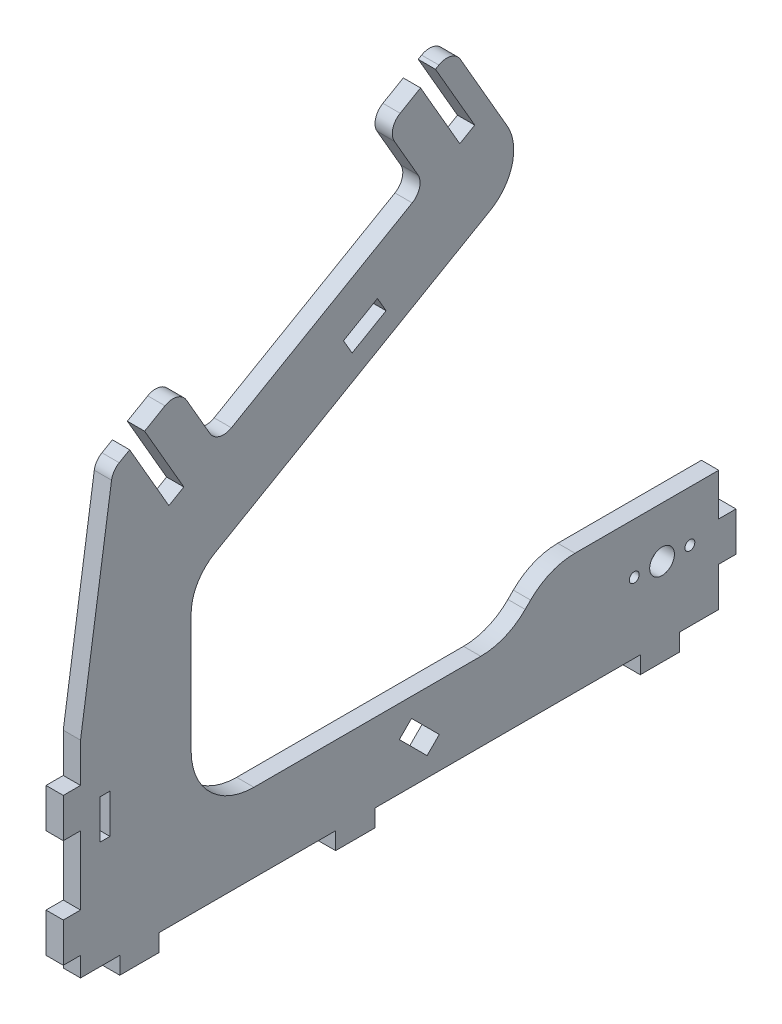
from build123d import *

# Parameters (mm, degrees)
BOSS_EXTRUDE1_DEPTH = 2.794
SKETCH2_R           = 2
SKETCH2_R_2         = 0.8
SKETCH2_W           = 1.5875
SKETCH2_H           = 6.35
CUT_EXTRUDE1_DEPTH  = 157.484941985
FILLET1_R           = 10.16


with BuildPart() as part:
    # Sketch1 → Boss-Extrude1 (new body)
    with BuildSketch(Plane(origin=(85.09, 0, 0), x_dir=(0, 0, -1), z_dir=(1, 0, 0))):
        with BuildLine():
            Line((-64.730392893, 73.865929303), (-64.730392893, 44.496360983))
            Line((-64.730392893, 44.496360983), (-13.648686174, 44.496360983))
            Line((-13.648686174, 44.496360983), (-6.823686174, 51.321360983))
            Line((-6.823686174, 51.321360983), (20.646158347, 51.321360983))
            Line((20.646158347, 51.321360983), (20.646158347, 44.496360983))
            Line((20.646158347, 44.496360983), (23.440158347, 44.496360983))
            Line((23.440158347, 44.496360983), (23.440158347, 38.146360983))
            Line((23.440158347, 38.146360983), (20.646158347, 38.146360983))
            Line((20.646158347, 38.146360983), (20.646158347, 31.796360983))
            Line((20.646158347, 31.796360983), (14.296158347, 31.796360983))
            Line((14.296158347, 31.796360983), (14.296158347, 29.002360983))
            Line((14.296158347, 29.002360983), (7.946158347, 29.002360983))
            Line((7.946158347, 29.002360983), (7.946158347, 31.796360983))
            Line((7.946158347, 31.796360983), (-35.003841653, 31.796360983))
            Line((-35.003841653, 31.796360983), (-35.003841653, 29.002360983))
            Line((-35.003841653, 29.002360983), (-41.353841653, 29.002360983))
            Line((-41.353841653, 29.002360983), (-41.353841653, 31.796360983))
            Line((-41.353841653, 31.796360983), (-69.928841653, 31.796360983))
            Line((-69.928841653, 31.796360983), (-69.928841653, 29.002360983))
            Line((-69.928841653, 29.002360983), (-76.278841653, 29.002360983))
            Line((-76.278841653, 29.002360983), (-76.278841653, 31.796360983))
            Line((-76.278841653, 31.796360983), (-82.628841653, 31.796360983))
            Line((-82.628841653, 31.796360983), (-82.628841653, 34.971360983))
            Line((-82.628841653, 34.971360983), (-85.422841653, 34.971360983))
            Line((-85.422841653, 34.971360983), (-85.422841653, 41.321360983))
            Line((-85.422841653, 41.321360983), (-82.628841653, 41.321360983))
            Line((-82.628841653, 41.321360983), (-82.628841653, 52.433860983))
            Line((-82.628841653, 52.433860983), (-85.422841653, 52.433860983))
            Line((-85.422841653, 52.433860983), (-85.422841653, 58.783860983))
            Line((-85.422841653, 58.783860983), (-82.628841653, 58.783860983))
            Line((-82.628841653, 58.783860983), (-82.628841653, 65.133860983))
            Line((-82.628841653, 65.133860983), (-77.61007114, 99.048207683))
            ThreePointArc((-77.61007114, 99.048207683), (-77.197997978, 100.104395563), (-76.367434478, 100.876082938))
            Line((-76.367434478, 100.876082938), (-74.680762236, 101.849883611))
            Line((-74.680762236, 101.849883611), (-68.330762236, 90.851360983))
            Line((-68.330762236, 90.851360983), (-65.911087258, 92.248360983))
            Line((-65.911087258, 92.248360983), (-72.261087258, 103.246883611))
            Line((-72.261087258, 103.246883611), (-68.96153047, 105.151883611))
            ThreePointArc((-68.96153047, 105.151883611), (-67.034130095, 105.405630684), (-65.491825944, 104.222179085))
            Line((-65.491825944, 104.222179085), (-61.681825944, 97.623065508))
            ThreePointArc((-61.681825944, 97.623065508), (-60.139521793, 96.439613909), (-58.212121418, 96.693360983))
            Line((-58.212121418, 96.693360983), (-28.956051228, 113.584360983))
            ThreePointArc((-28.956051228, 113.584360983), (-27.772599629, 115.126665134), (-28.026346702, 117.054065508))
            Line((-28.026346702, 117.054065508), (-31.836346702, 123.653179085))
            ThreePointArc((-31.836346702, 123.653179085), (-32.090093775, 125.58057946), (-30.906642177, 127.122883611))
            Line((-30.906642177, 127.122883611), (-27.607085388, 129.027883611))
            Line((-27.607085388, 129.027883611), (-21.257085388, 118.029360983))
            Line((-21.257085388, 118.029360983), (-18.83741041, 119.426360983))
            Line((-18.83741041, 119.426360983), (-25.18741041, 130.424883611))
            Line((-25.18741041, 130.424883611), (-24.637484279, 130.742383611))
            ThreePointArc((-24.637484279, 130.742383611), (-22.710083904, 130.996130684), (-21.167779753, 129.812679085))
            Line((-21.167779753, 129.812679085), (-13.547779753, 116.614451931))
            ThreePointArc((-13.547779753, 116.614451931), (-12.786538533, 110.832250808), (-16.33689333, 106.205338355))
            Line((-16.33689333, 106.205338355), (-60.920392893, 80.46504288))
            ThreePointArc((-60.920392893, 80.46504288), (-63.70950647, 77.675929303), (-64.730392893, 73.865929303))
        make_face()
    extrude(amount=BOSS_EXTRUDE1_DEPTH)

    # Sketch2 → Cut-Extrude1 (cut, through all)
    with BuildSketch(Plane(origin=(87.884, 0, 0), x_dir=(0, 0, -1), z_dir=(1, 0, 0))):
        with Locations((11.471158347, 43.146360983)):
            Circle(SKETCH2_R)
        with Locations((15.971158347, 43.146360983)):
            Circle(SKETCH2_R_2)
        with Locations((6.971158347, 43.146360983)):
            Circle(SKETCH2_R_2)
        Polygon((-24.575557246, 36.901889269), (-29.065685306, 41.392017329), (-31.041341653, 39.416360983), (-26.551213592, 34.926232922), align=None)
        with Locations((-78.660091653, 52.433860983)):
            Rectangle(SKETCH2_W, SKETCH2_H)
        Polygon((-38.682130644, 97.41042469), (-33.18286933, 100.58542469), (-34.57986933, 103.005099669), (-40.079130644, 99.830099669), align=None)
    extrude(amount=-CUT_EXTRUDE1_DEPTH, mode=Mode.SUBTRACT)

    # Fillet1
    fillet1_edges = [part.edges().sort_by_distance(p)[0] for p in [
        (86.487, 51.321360983, 6.823686174),
        (86.487, 44.496360983, 13.648686174),
        (86.487, 44.496360983, 64.730392893),
    ]]
    fillet(fillet1_edges, radius=FILLET1_R)


solid = part.part
